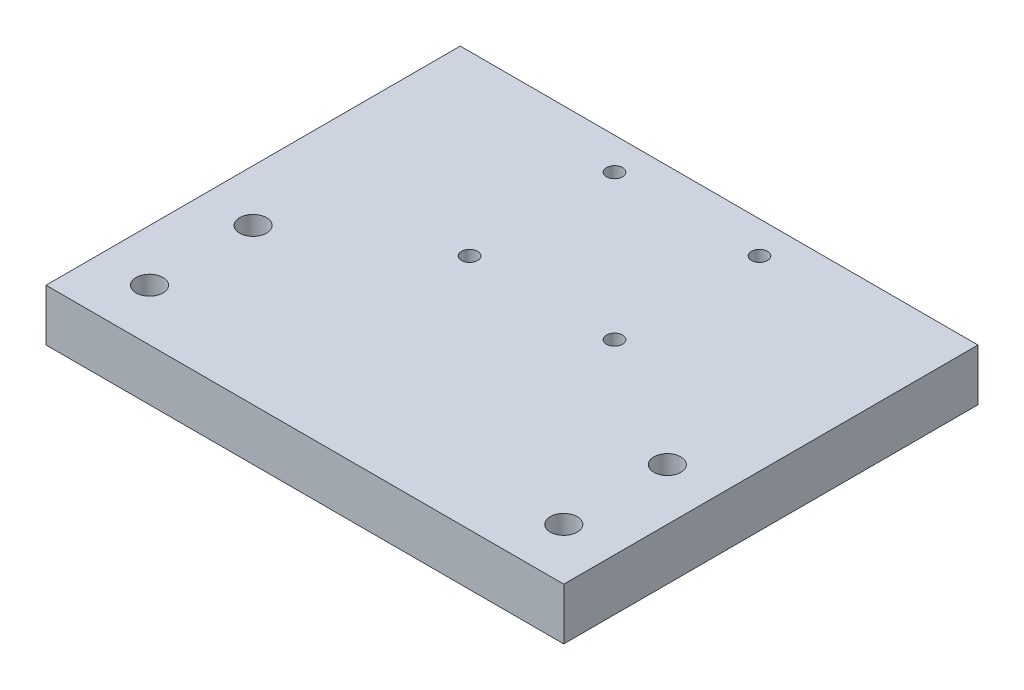
from build123d import *

# Parameters (mm, degrees)
SKETCH_1_W          = 100
SKETCH_1_H          = 80
EXTRUDE_1_DEPTH     = 10
SKETCH_3_R          = 2.6
CUT_EXTRUDE_2_DEPTH = 65.807406984
SKETCH_4_R          = 1.55
CUT_EXTRUDE_3_DEPTH = 65.807406984


with BuildPart() as part:
    # 草图1 → 凸台-拉伸1 (new body)
    with BuildSketch(Plane(origin=(0, 0, 0), x_dir=(1, 0, 0), z_dir=(0, 1, 0))):
        Rectangle(SKETCH_1_W, SKETCH_1_H)
    extrude(amount=EXTRUDE_1_DEPTH)

    # 草图3 → 切除-拉伸2 (cut, through all)
    with BuildSketch(Plane.XZ):
        with Locations((40, 30)):
            Circle(SKETCH_3_R)
        with Locations((40, 10)):
            Circle(SKETCH_3_R)
        with Locations((-40, 30)):
            Circle(SKETCH_3_R)
        with Locations((-40, 10)):
            Circle(SKETCH_3_R)
    extrude(amount=-CUT_EXTRUDE_2_DEPTH, mode=Mode.SUBTRACT)

    # 草图4 → 切除-拉伸3 (cut, through all)
    with BuildSketch(Plane(origin=(0, 10, 0), x_dir=(1, 0, 0), z_dir=(0, 1, 0))):
        with Locations((14, 33.8)):
            Circle(SKETCH_4_R)
        with Locations((14, 5.8)):
            Circle(SKETCH_4_R)
        with Locations((-14, 33.8)):
            Circle(SKETCH_4_R)
        with Locations((-14, 5.8)):
            Circle(SKETCH_4_R)
    extrude(amount=-CUT_EXTRUDE_3_DEPTH, mode=Mode.SUBTRACT)


solid = part.part
